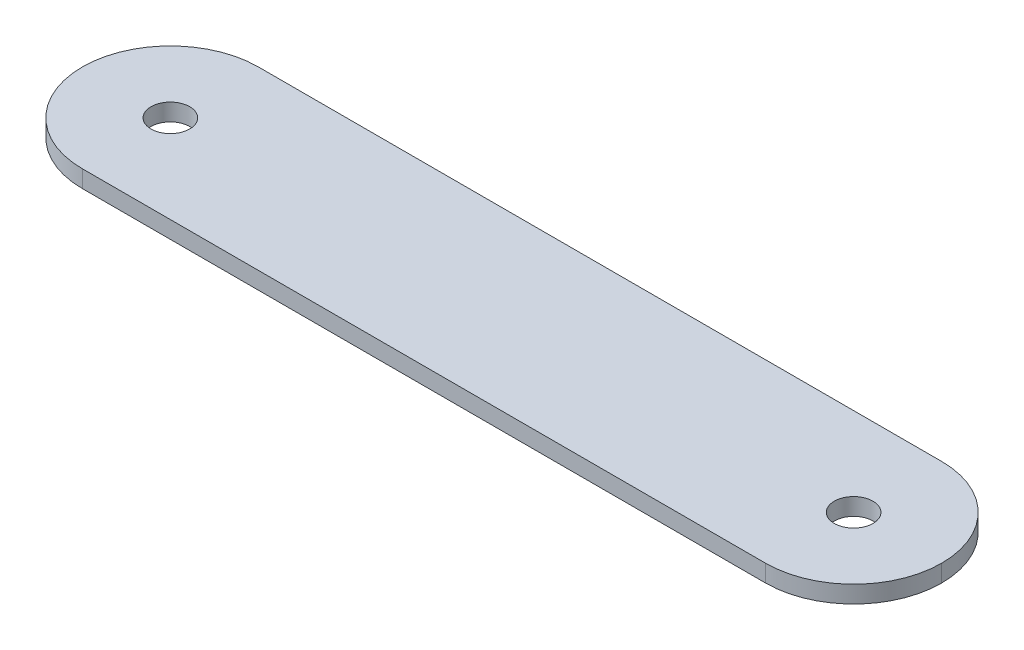
from build123d import *

# Parameters (mm, degrees)
SKETCH1_W           = 100
SKETCH1_H           = 20.5
SKETCH1_R           = 2.25
BOSS_EXTRUDE1_DEPTH = 2
FILLET1_R           = 10.25


with BuildPart() as part:
    # Sketch1 → Boss-Extrude1 (new body)
    with BuildSketch(Plane(origin=(0, 0, 0), x_dir=(1, 0, 0), z_dir=(0, 1, 0))):
        with Locations((50, 10.25)):
            Rectangle(SKETCH1_W, SKETCH1_H)
        with Locations(Location((10.25, 10.25, 0), (0, 0, 270))):
            Circle(SKETCH1_R, mode=Mode.SUBTRACT)
        with Locations(Location((89.75, 10.25, 0), (0, 0, 90))):
            Circle(SKETCH1_R, mode=Mode.SUBTRACT)
    extrude(amount=BOSS_EXTRUDE1_DEPTH)

    # Fillet1
    fillet1_edges = [part.edges().sort_by_distance(p)[0] for p in [
        (0, 1, 0),
        (0, 1, -20.5),
        (100, 1, -20.5),
        (100, 1, 0),
    ]]
    fillet(fillet1_edges, radius=FILLET1_R - 0.0001)  # a hair under: the kernel refuses the full size


solid = part.part
